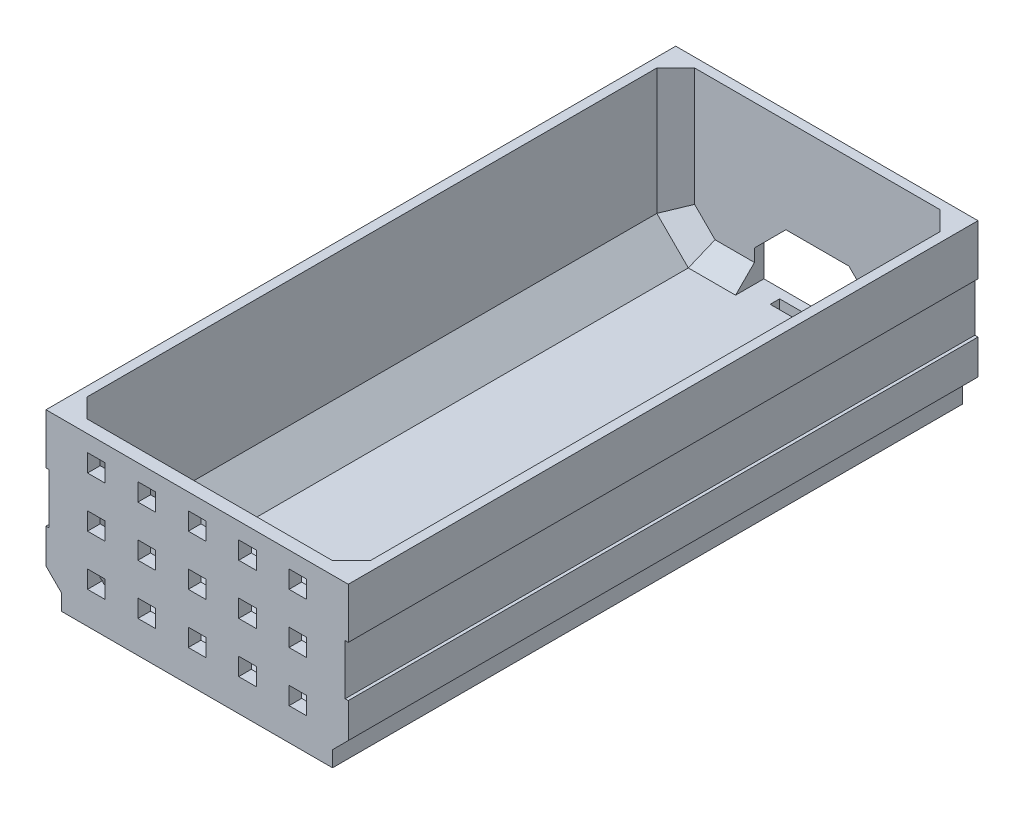
from build123d import *

# Parameters (mm, degrees)
RESSALTO_EXTRUS_O1_DEPTH = 100
RESSALTO_EXTRUS_O3_REACH = 107.835
ESBO_O3_W                = 45
ESBO_O3_H                = 1.5
CORTE_EXTRUS_O1_DEPTH    = 103.343783397
ESBO_O5_W                = 12
ESBO_O5_H                = 1.5
CORTE_EXTRUS_O2_DEPTH    = 106.834776893
ESBO_O6_W                = 45
ESBO_O6_H                = 2
RESSALTO_EXTRUS_O4_DEPTH = 25
ESBO_O7_W                = 2.8
ESBO_O7_H                = 2.8
CORTE_EXTRUS_O3_DEPTH    = 10
CORTE_EXTRUS_O4_DEPTH    = 104.788245963
RESSALTO_EXTRUS_O5_DEPTH = 100
ESBO_O10_W               = 0.5
ESBO_O10_H               = 8
CORTE_EXTRUS_O5_DEPTH    = 104.788245963
CHANFRO1_SIZE            = 3
CHANFRO2_SIZE            = 3


with BuildPart() as part:
    # Esboço1 → Ressalto-extrusão1 (new body)
    with BuildSketch(Plane.XY):
        Polygon((-22.5, 12.5), (-22.5, -7.5), (-17.5, -12.5), (17.5, -12.5), (22.5, -7.5), (22.5, 12.5), (24, 12.5), (24, -9), (19, -14), (-19, -14), (-24, -9), (-24, 12.5), align=None)
    extrude(amount=RESSALTO_EXTRUS_O1_DEPTH)

    # Ressalto-extrusão3: up to this face of the body (flat: up to its plane)
    ressalto_extrus_o3_end = Plane(part.part.faces().sort_by_distance((-23.25, 12.5, 50))[0])
    # Esboço3 → Ressalto-extrusão3 (add, up to the picked face)
    with BuildSketch(Plane(origin=(0, -12.5, 0), x_dir=(1, 0, 0), z_dir=(0, 1, 0)), mode=Mode.PRIVATE) as ressalto_extrus_o3_sk1:
        with Locations((0, -0.75)):
            Rectangle(ESBO_O3_W, ESBO_O3_H)
    ressalto_extrus_o3_tool1 = split(extrude(ressalto_extrus_o3_sk1.sketch, amount=RESSALTO_EXTRUS_O3_REACH, mode=Mode.PRIVATE), bisect_by=ressalto_extrus_o3_end, keep=Keep.BOTH, mode=Mode.PRIVATE)
    add(ressalto_extrus_o3_tool1.solids().sort_by(Axis((0, -12.5, 0.75), (0, 1, 0)))[0])

    # Esboço4 → Corte-extrusão1 (cut, through all)
    with BuildSketch(Plane.XY.offset(1.5)):
        Polygon((-10, -12.5), (10, -12.5), (10, -7.5), (5, -2.5), (-5, -2.5), (-10, -7.5), align=None)
    extrude(amount=-CORTE_EXTRUS_O1_DEPTH, mode=Mode.SUBTRACT)

    # Esboço5 → Corte-extrusão2 (cut, through all)
    with BuildSketch(Plane(origin=(0, -12.5, 0), x_dir=(1, 0, 0), z_dir=(0, 1, 0))):
        with Locations((0, -2.25)):
            Rectangle(ESBO_O5_W, ESBO_O5_H)
    extrude(amount=-CORTE_EXTRUS_O2_DEPTH, mode=Mode.SUBTRACT)

    # Esboço6 → Ressalto-extrusão4 (add)
    with BuildSketch(Plane(origin=(0, -12.5, 0), x_dir=(1, 0, 0), z_dir=(0, 1, 0))):
        with Locations((0, -99)):
            Rectangle(ESBO_O6_W, ESBO_O6_H)
    extrude(amount=RESSALTO_EXTRUS_O4_DEPTH)

    # Esboço7 → Corte-extrusão3 (cut)
    with BuildSketch(Plane.XY.offset(100)):
        with Locations((-8, 8.5)):
            Rectangle(ESBO_O7_W, ESBO_O7_H)
        with Locations((-16, 8.5)):
            Rectangle(ESBO_O7_W, ESBO_O7_H)
        with Locations((0, 8.5)):
            Rectangle(ESBO_O7_W, ESBO_O7_H)
        with Locations((8, 8.5)):
            Rectangle(ESBO_O7_W, ESBO_O7_H)
        with Locations((16, 8.5)):
            Rectangle(ESBO_O7_W, ESBO_O7_H)
        with Locations((-8, 0.5)):
            Rectangle(ESBO_O7_W, ESBO_O7_H)
        with Locations((0, 0.5)):
            Rectangle(ESBO_O7_W, ESBO_O7_H)
        with Locations((8, 0.5)):
            Rectangle(ESBO_O7_W, ESBO_O7_H)
        with Locations((16, 0.5)):
            Rectangle(ESBO_O7_W, ESBO_O7_H)
        with Locations((-8, -7.5)):
            Rectangle(ESBO_O7_W, ESBO_O7_H)
        with Locations((0, -7.5)):
            Rectangle(ESBO_O7_W, ESBO_O7_H)
        with Locations((8, -7.5)):
            Rectangle(ESBO_O7_W, ESBO_O7_H)
        with Locations((16, -7.5)):
            Rectangle(ESBO_O7_W, ESBO_O7_H)
        with Locations((-16, 0.5)):
            Rectangle(ESBO_O7_W, ESBO_O7_H)
        with Locations((-16, -7.5)):
            Rectangle(ESBO_O7_W, ESBO_O7_H)
    extrude(amount=-CORTE_EXTRUS_O3_DEPTH, mode=Mode.SUBTRACT)

    # Esboço8 → Corte-extrusão4 (cut, through all)
    with BuildSketch(Plane(origin=(0, 0, 0), x_dir=(-1, 0, 0), z_dir=(0, 0, -1))):
        Polygon((-22.5, -10.5), (-22.5, -12.5), (-20.5, -12.5), align=None)
        Polygon((20.5, -12.5), (22.5, -12.5), (22.5, -10.5), align=None)
    extrude(amount=-CORTE_EXTRUS_O4_DEPTH, mode=Mode.SUBTRACT)

    # Esboço9 → Ressalto-extrusão5 (add, through all)
    with BuildSketch(Plane(origin=(0, 0, 0), x_dir=(-1, 0, 0), z_dir=(0, 0, -1))):
        Polygon((-19, -14), (-21.5, -14), (-21.5, -11.5), align=None)
        Polygon((19, -14), (21.5, -14), (21.5, -11.5), align=None)
    extrude(amount=-RESSALTO_EXTRUS_O5_DEPTH)

    # Esboço10 → Corte-extrusão5 (cut, through all)
    with BuildSketch(Plane(origin=(0, 0, 0), x_dir=(-1, 0, 0), z_dir=(0, 0, -1))):
        with Locations((-23.75, 0.5)):
            Rectangle(ESBO_O10_W, ESBO_O10_H)
        with Locations((23.75, 0.5)):
            Rectangle(ESBO_O10_W, ESBO_O10_H)
    extrude(amount=-CORTE_EXTRUS_O5_DEPTH, mode=Mode.SUBTRACT)

    # Chanfro1
    # the kernel refuses this chamfer: 3 mm, written as the material it adds along each edge
    with BuildSketch(Plane(origin=(22.5, -15.215048964, 98), x_dir=(0.027495876610586768, 0, -0.9996219169112968), z_dir=(0, 1, 0))) as chanfro1_piece_1_section:
        Polygon((CHANFRO1_SIZE * 0.999621916911, CHANFRO1_SIZE * 0.0274958766106), (-CHANFRO1_SIZE * 0.0274958766106, CHANFRO1_SIZE * 0.999621916911), (0, 0), align=None)
    chanfro1_piece_1 = extrude(amount=27.715048964, mode=Mode.PRIVATE)
    chanfro1_piece_1 = split(chanfro1_piece_1, bisect_by=Plane(origin=(27.146986971, -2.853013029, 96.73534202), z_dir=(-0.7071067811865475, 0.7071067811865476, 0)), keep=Keep.TOP, mode=Mode.PRIVATE)
    add(chanfro1_piece_1)
    with BuildSketch(Plane(origin=(12.04463656, -17.95536344, 98), x_dir=(-0.7068394360706735, 0.7068394360706735, 0.027495876610586778), z_dir=(0.7071067811865476, 0.7071067811865475, 0))) as chanfro1_piece_2_section:
        Polygon((CHANFRO1_SIZE * 0.999621916911, -CHANFRO1_SIZE * 0.0274958766106), (-CHANFRO1_SIZE * 0.0274958766106, -CHANFRO1_SIZE * 0.999621916911), (0, 0), align=None)
    chanfro1_piece_2 = extrude(amount=22.50116574, mode=Mode.PRIVATE)
    chanfro1_piece_2 = split(chanfro1_piece_2, bisect_by=Plane(origin=(16.362312496, -12.5, 97.266244129), z_dir=(0, 1, 0)), keep=Keep.TOP, mode=Mode.PRIVATE)
    chanfro1_piece_2 = split(chanfro1_piece_2, bisect_by=Plane(origin=(16.362312496, -8.9, 97.266244129), z_dir=(0, -1, 0)), keep=Keep.TOP, mode=Mode.PRIVATE)
    add(chanfro1_piece_2)
    with BuildSketch(Plane(origin=(12.04463656, -17.95536344, 98), x_dir=(-0.7068394360706735, 0.7068394360706735, 0.027495876610586778), z_dir=(0.7071067811865476, 0.7071067811865475, 0))) as chanfro1_piece_3_section:
        Polygon((CHANFRO1_SIZE * 0.999621916911, -CHANFRO1_SIZE * 0.0274958766106), (-CHANFRO1_SIZE * 0.0274958766106, -CHANFRO1_SIZE * 0.999621916911), (0, 0), align=None)
    chanfro1_piece_3 = extrude(amount=22.50116574, mode=Mode.PRIVATE)
    chanfro1_piece_3 = split(chanfro1_piece_3, bisect_by=Plane(origin=(22.5, -7.314063038, 97.124733651), z_dir=(-1, 0, 0)), keep=Keep.TOP, mode=Mode.PRIVATE)
    chanfro1_piece_3 = split(chanfro1_piece_3, bisect_by=Plane(origin=(17.4, -7.314063038, 97.124733651), z_dir=(1, 0, 0)), keep=Keep.TOP, mode=Mode.PRIVATE)
    add(chanfro1_piece_3)
    with BuildSketch(Plane(origin=(25.215048964, -12.5, 98), x_dir=(0, -0.02749587661058619, -0.9996219169112968), z_dir=(-1, 0, 0))) as chanfro1_piece_4_section:
        Polygon((CHANFRO1_SIZE * 0.999621916911, -CHANFRO1_SIZE * 0.0274958766106), (-CHANFRO1_SIZE * 0.0274958766106, -CHANFRO1_SIZE * 0.999621916911), (0, 0), align=None)
    chanfro1_piece_4 = extrude(amount=50.430097928, mode=Mode.PRIVATE)
    chanfro1_piece_4 = split(chanfro1_piece_4, bisect_by=Plane(origin=(-9.263513514, -20.736486486, 97.013513514), z_dir=(0.7071067811865475, 0.7071067811865476, 0)), keep=Keep.TOP, mode=Mode.PRIVATE)
    chanfro1_piece_4 = split(chanfro1_piece_4, bisect_by=Plane(origin=(9.263513514, -20.736486486, 97.013513514), z_dir=(-0.7071067811865475, 0.7071067811865476, 0)), keep=Keep.TOP, mode=Mode.PRIVATE)
    add(chanfro1_piece_4)
    with BuildSketch(Plane(origin=(-27.95536344, -2.04463656, 98), x_dir=(0.7068394360706733, 0.7068394360706736, 0.027495876610586757), z_dir=(0.7071067811865476, -0.7071067811865475, 0))) as chanfro1_piece_5_section:
        Polygon((CHANFRO1_SIZE * 0.999621916911, -CHANFRO1_SIZE * 0.0274958766106), (-CHANFRO1_SIZE * 0.0274958766106, -CHANFRO1_SIZE * 0.999621916911), (0, 0), align=None)
    chanfro1_piece_5 = extrude(amount=22.50116574, mode=Mode.PRIVATE)
    chanfro1_piece_5 = split(chanfro1_piece_5, bisect_by=Plane(origin=(-22.5, -3.439339828, 97.957106781), z_dir=(1, 0, 0)), keep=Keep.TOP, mode=Mode.PRIVATE)
    chanfro1_piece_5 = split(chanfro1_piece_5, bisect_by=Plane(origin=(-17.4, -3.439339828, 97.957106781), z_dir=(-1, 0, 0)), keep=Keep.TOP, mode=Mode.PRIVATE)
    add(chanfro1_piece_5)
    with BuildSketch(Plane(origin=(-27.95536344, -2.04463656, 98), x_dir=(0.7068394360706733, 0.7068394360706736, 0.027495876610586757), z_dir=(0.7071067811865476, -0.7071067811865475, 0))) as chanfro1_piece_6_section:
        Polygon((CHANFRO1_SIZE * 0.999621916911, -CHANFRO1_SIZE * 0.0274958766106), (-CHANFRO1_SIZE * 0.0274958766106, -CHANFRO1_SIZE * 0.999621916911), (0, 0), align=None)
    chanfro1_piece_6 = extrude(amount=22.50116574, mode=Mode.PRIVATE)
    chanfro1_piece_6 = split(chanfro1_piece_6, bisect_by=Plane(origin=(-16.362312496, -12.5, 97.266244129), z_dir=(0, 1, 0)), keep=Keep.TOP, mode=Mode.PRIVATE)
    chanfro1_piece_6 = split(chanfro1_piece_6, bisect_by=Plane(origin=(-16.362312496, -8.9, 97.266244129), z_dir=(0, -1, 0)), keep=Keep.TOP, mode=Mode.PRIVATE)
    add(chanfro1_piece_6)
    with BuildSketch(Plane(origin=(-22.5, -15.215048964, 98), x_dir=(-0.027495876610586768, 0, -0.9996219169112968), z_dir=(0, 1, 0))) as chanfro1_piece_7_section:
        Polygon((CHANFRO1_SIZE * 0.999621916911, -CHANFRO1_SIZE * 0.0274958766106), (-CHANFRO1_SIZE * 0.0274958766106, -CHANFRO1_SIZE * 0.999621916911), (0, 0), align=None)
    chanfro1_piece_7 = extrude(amount=27.715048964, mode=Mode.PRIVATE)
    chanfro1_piece_7 = split(chanfro1_piece_7, bisect_by=Plane(origin=(-27.146986971, -2.853013029, 96.73534202), z_dir=(0.7071067811865475, 0.7071067811865476, 0)), keep=Keep.TOP, mode=Mode.PRIVATE)
    add(chanfro1_piece_7)

    # Chanfro2
    chanfro2_edges = [part.edges().sort_by_distance(p)[0] for p in [
        (-13.75, -12.5, 1.5),
        (20, -10, 1.5),
        (-22.5, 2.5, 1.5),
        (-20, -10, 1.5),
        (22.5, 2.5, 1.5),
        (13.75, -12.5, 1.5),
    ]]
    chamfer(chanfro2_edges, length=CHANFRO2_SIZE)


solid = part.part
